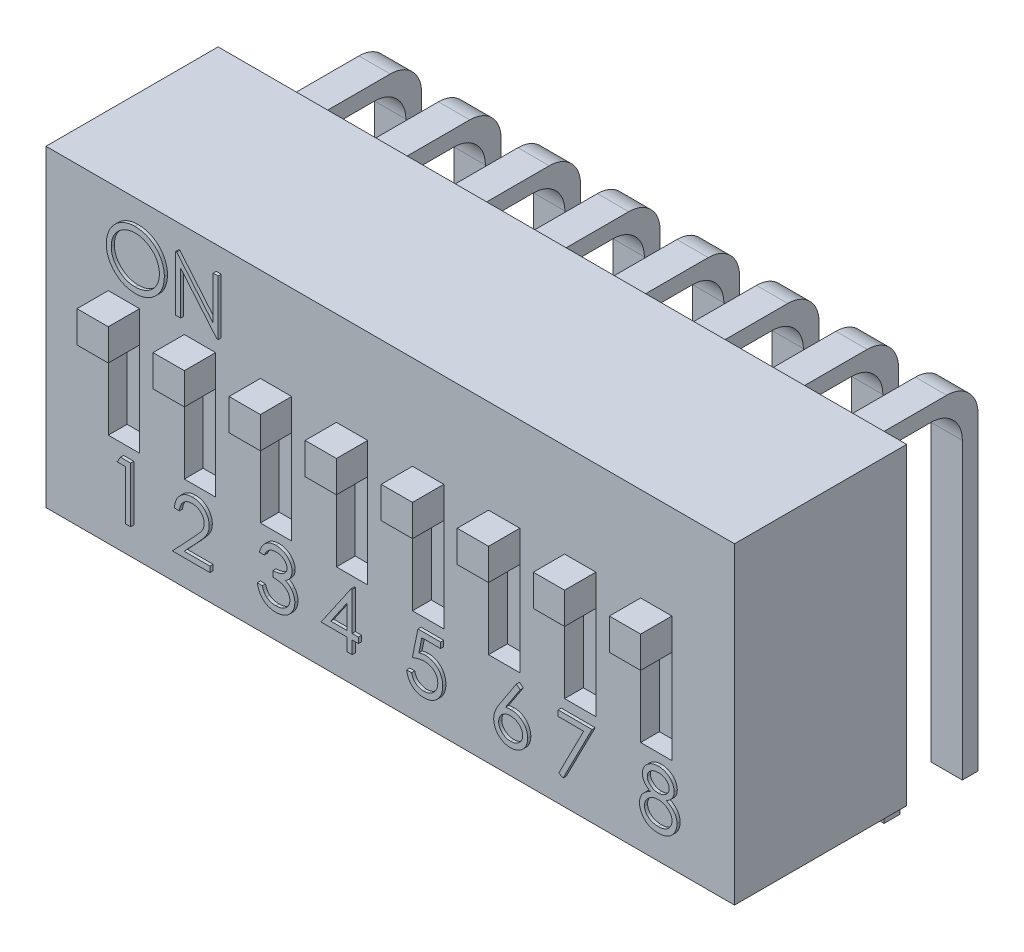
from build123d import *

# Parameters (mm, degrees)
SKETCH_1_W                     = 22
SKETCH_1_H                     = 10
EXTRUDE_1_DEPTH                = 5.5
SKETCH_42_W                    = 1
SKETCH_42_H                    = 4
CUT_EXTRUDE_1_DEPTH            = 0.6
SKETCH_43_W                    = 1
SKETCH_43_H                    = 1.00419659
EXTRUDE_42_DEPTH               = 1.6
WRAP_1_DEPTH                   = 0.1
SKETCH_45_W                    = 1
SKETCH_45_H                    = 0.5
EXTRUDE_43_DEPTH               = 1.5
SKETCH_46_W                    = 1
SKETCH_46_H                    = 0.5
EXTRUDE_44_DEPTH               = 2.6
FILLET_1_R                     = 1
PATTERN_LINEAR_1_COUNT         = 8
PATTERN_LINEAR_1_PITCH         = 2.54
FILLET_1_OF_PATTERN_LINEAR_1_R = 1
SKETCH_47_W                    = 1
SKETCH_47_H                    = 0.5
EXTRUDE_45_DEPTH               = 4
SKETCH_49_W                    = 1
SKETCH_49_H                    = 0.5
EXTRUDE_46_DEPTH               = 10.4
FILLET_2_R                     = 1
PATTERN_LINEAR_2_COUNT         = 8
PATTERN_LINEAR_2_PITCH         = 2.54
FILLET_2_OF_PATTERN_LINEAR_2_R = 1


# Read off the part's stored shape, not the designer's step: 包覆1
with BuildPart() as part:
    # 草图1 → 凸台-拉伸1 (new body)
    with BuildSketch(Plane.XY.offset(6.5)):
        with Locations((11, 5)):
            Rectangle(SKETCH_1_W, SKETCH_1_H)
    extrude(amount=-EXTRUDE_1_DEPTH)

    # 草图42 → 切除-拉伸1 (cut)
    with BuildSketch(Plane.XY.offset(6.5)):
        with Locations((12.21, 5)):
            Rectangle(SKETCH_42_W, SKETCH_42_H)
        with Locations((17.07, 5)):
            Rectangle(SKETCH_42_W, SKETCH_42_H)
        with Locations((19.5, 5)):
            Rectangle(SKETCH_42_W, SKETCH_42_H)
        with Locations((2.49, 5)):
            Rectangle(SKETCH_42_W, SKETCH_42_H)
        with Locations((4.92, 5)):
            Rectangle(SKETCH_42_W, SKETCH_42_H)
        with Locations((7.35, 5)):
            Rectangle(SKETCH_42_W, SKETCH_42_H)
        with Locations((9.78, 5)):
            Rectangle(SKETCH_42_W, SKETCH_42_H)
        with Locations((14.64, 5)):
            Rectangle(SKETCH_42_W, SKETCH_42_H)
    extrude(amount=-CUT_EXTRUDE_1_DEPTH, mode=Mode.SUBTRACT)

    # 草图43 → 凸台-拉伸42 (add)
    with BuildSketch(Plane.XY.offset(5.9)):
        with Locations((2.49, 6.497901705)):
            Rectangle(SKETCH_43_W, SKETCH_43_H)
        with Locations((4.92, 6.497901705)):
            Rectangle(SKETCH_43_W, SKETCH_43_H)
        with Locations((7.35, 6.497901705)):
            Rectangle(SKETCH_43_W, SKETCH_43_H)
        with Locations((9.78, 6.497901705)):
            Rectangle(SKETCH_43_W, SKETCH_43_H)
        with Locations((12.21, 6.497901705)):
            Rectangle(SKETCH_43_W, SKETCH_43_H)
        with Locations((14.64, 6.497901705)):
            Rectangle(SKETCH_43_W, SKETCH_43_H)
        with Locations((17.07, 6.497901705)):
            Rectangle(SKETCH_43_W, SKETCH_43_H)
        with Locations((19.5, 6.497901705)):
            Rectangle(SKETCH_43_W, SKETCH_43_H)
    extrude(amount=EXTRUDE_42_DEPTH)

    # 包覆1 outline → 包覆1 (add)
    # profile 1 of 10: a face of its own
    with BuildSketch(Plane.XY.offset(6.5)):
        with BuildLine():
            add(Edge.make_bspline(
                [(3.880857562, 8.378376083), (3.880076445, 8.346647529), (3.878536774, 8.284106873), (3.865348541, 8.192312359), (3.844665179, 8.104072207), (3.815134522, 8.019533723), (3.777223268, 7.938607728), (3.730528004, 7.86150716), (3.675524298, 7.788206742), (3.612927988, 7.719509487), (3.544690162, 7.65651473), (3.471498718, 7.601623074), (3.394999703, 7.554389091), (3.3142087, 7.516700493), (3.230197173, 7.486577343), (3.142213225, 7.466039311), (3.050669128, 7.452791475), (2.988242074, 7.451270239), (2.956511943, 7.450497032)],
                knots=[0, 0, 0, 0, 0.065226504, 0.128568996, 0.190320378, 0.251377989, 0.312387528, 0.373788704, 0.43643116, 0.500566755, 0.564686795, 0.627135518, 0.688455409, 0.749245746, 0.810155177, 0.871670926, 0.934773496, 1, 1, 1, 1], degree=3))
            add(Edge.make_bspline(
                [(2.942378217, 9.304841762), (2.975039445, 9.304014508), (3.039188792, 9.302389714), (3.133468601, 9.289952229), (3.22347486, 9.268435108), (3.309940763, 9.23977797), (3.391832065, 9.201549768), (3.469765157, 9.155343364), (3.543554614, 9.100674672), (3.612205865, 9.037966292), (3.675029011, 8.969737329), (3.730377771, 8.896925049), (3.776764165, 8.819969701), (3.814857002, 8.739102536), (3.844741619, 8.654506441), (3.865363518, 8.565730416), (3.878536316, 8.473349663), (3.880076331, 8.410340092), (3.880857562, 8.378376083)],
                knots=[0, 0, 0, 0, 0.066570035, 0.130749041, 0.1934128, 0.254989399, 0.316113556, 0.377261758, 0.439400784, 0.502970589, 0.566524976, 0.628231103, 0.689090611, 0.749344669, 0.810169593, 0.871609824, 0.934869184, 1, 1, 1, 1], degree=3))
            add(Edge.make_bspline(
                [(2.026512833, 8.369895848), (2.026782272, 8.390877392), (2.027317752, 8.432575787), (2.033764359, 8.494496653), (2.043118867, 8.555421707), (2.056525386, 8.615177701), (2.074059282, 8.673618356), (2.0947482, 8.731146716), (2.120017091, 8.787179783), (2.148582338, 8.841983001), (2.180464281, 8.894702064), (2.21567944, 8.944534235), (2.252990916, 8.991897674), (2.293894689, 9.035565013), (2.33704266, 9.076806578), (2.383134779, 9.114988582), (2.431889799, 9.150455324), (2.483517506, 9.182417162), (2.536745764, 9.211324345), (2.591616203, 9.236130595), (2.647383603, 9.257421269), (2.704309159, 9.274677558), (2.762241707, 9.288300846), (2.821307686, 9.297577568), (2.88146004, 9.304040617), (2.921984792, 9.304573565), (2.942378217, 9.304841762)],
                knots=[0, 0, 0, 0, 0.043208986, 0.085872872, 0.128120007, 0.170151964, 0.211917621, 0.253753003, 0.296006409, 0.338443357, 0.381015368, 0.422820479, 0.464089056, 0.505125849, 0.545974971, 0.586985211, 0.628338592, 0.670083802, 0.711991602, 0.753039155, 0.794049395, 0.834885543, 0.875498313, 0.9165473, 0.958003779, 1, 1, 1, 1], degree=3))
            add(Edge.make_bspline(
                [(2.956511943, 7.450497032), (2.924548099, 7.451277874), (2.861538855, 7.452817121), (2.769042016, 7.466011718), (2.680203629, 7.486644835), (2.595277746, 7.516131734), (2.514217008, 7.554240418), (2.436862879, 7.600708497), (2.363525848, 7.655846223), (2.294813936, 7.718422235), (2.231944301, 7.786544406), (2.177133028, 7.859536273), (2.130654499, 7.935965809), (2.092673772, 8.016045116), (2.062604778, 8.099387074), (2.042090842, 8.186547616), (2.028818358, 8.277029827), (2.027288892, 8.338636367), (2.026512833, 8.369895848)],
                knots=[0, 0, 0, 0, 0.065818877, 0.129746527, 0.192071954, 0.253459424, 0.314569588, 0.376279881, 0.439025654, 0.503267029, 0.567492823, 0.629704796, 0.690999649, 0.751451651, 0.812004364, 0.873149681, 0.935635484, 1, 1, 1, 1], degree=3))
        make_face()
        with BuildLine():
            add(Edge.make_bspline(
                [(2.184810554, 8.370602534), (2.185453044, 8.34512078), (2.18671702, 8.294990287), (2.197782938, 8.22152777), (2.21482814, 8.150927721), (2.23995467, 8.083576441), (2.2713774, 8.018894997), (2.310196507, 7.957457182), (2.35618819, 7.899246393), (2.408431316, 7.844669015), (2.465542363, 7.794853868), (2.526186238, 7.751127864), (2.589713255, 7.714131429), (2.656289075, 7.683991571), (2.725558272, 7.660108647), (2.797967196, 7.643740448), (2.873033499, 7.632967897), (2.924201726, 7.631933374), (2.950151766, 7.631408713)],
                knots=[0, 0, 0, 0, 0.064503999, 0.126899322, 0.18774654, 0.248149733, 0.308586065, 0.369583005, 0.431826965, 0.496179723, 0.560667855, 0.623504455, 0.685260411, 0.746536822, 0.808327352, 0.870486188, 0.934316883, 1, 1, 1, 1], degree=3))
            add(Edge.make_bspline(
                [(2.950151766, 9.123930081), (2.933412645, 9.123726029), (2.900094431, 9.123319876), (2.850562145, 9.117969892), (2.801681289, 9.110344909), (2.753441769, 9.099468507), (2.706045425, 9.084649798), (2.659050465, 9.067595055), (2.612885434, 9.046820934), (2.567702736, 9.023349769), (2.523900297, 8.99737075), (2.482568499, 8.968658788), (2.443600342, 8.937887215), (2.407091235, 8.904984217), (2.373148382, 8.869782235), (2.341103711, 8.832814936), (2.31224166, 8.79302569), (2.285790596, 8.751493461), (2.262120295, 8.708272346), (2.241071882, 8.663817376), (2.223854307, 8.617765923), (2.209812553, 8.570617597), (2.198170982, 8.522447072), (2.190795949, 8.472888926), (2.18538718, 8.422192183), (2.185004242, 8.387931487), (2.184810554, 8.370602534)],
                knots=[0, 0, 0, 0, 0.042023329, 0.083644911, 0.124983795, 0.166247461, 0.207701556, 0.249631071, 0.29174177, 0.334742875, 0.377460169, 0.419556319, 0.461044176, 0.502096284, 0.542890714, 0.583800819, 0.624863583, 0.666224689, 0.707399186, 0.748556678, 0.789654591, 0.830739726, 0.872070142, 0.913993395, 0.95649813, 1, 1, 1, 1], degree=3))
            add(Edge.make_bspline(
                [(3.722559841, 8.378729426), (3.722357693, 8.395821764), (3.721956695, 8.429727564), (3.716643622, 8.479852659), (3.709033253, 8.52886519), (3.698065539, 8.576572741), (3.683929152, 8.622987474), (3.666498236, 8.668065796), (3.645943739, 8.71197564), (3.62235388, 8.75460848), (3.595837176, 8.795517971), (3.566861902, 8.834627123), (3.534927778, 8.871201481), (3.500947202, 8.906143966), (3.464071399, 8.938709331), (3.42446741, 8.968908379), (3.382616032, 8.99746991), (3.338303497, 9.02323557), (3.292571425, 9.047030045), (3.245644946, 9.067416066), (3.198055678, 9.084738523), (3.149924637, 9.099513343), (3.100846707, 9.11030231), (3.051153508, 9.117976764), (3.00091379, 9.123318014), (2.967126136, 9.123725411), (2.950151766, 9.123930081)],
                knots=[0, 0, 0, 0, 0.042915082, 0.085129971, 0.126473319, 0.167453038, 0.207976333, 0.248249378, 0.288749987, 0.329669857, 0.370537287, 0.411128564, 0.451818913, 0.492405877, 0.533485862, 0.575263062, 0.617440613, 0.660671688, 0.703940204, 0.746867522, 0.7890793, 0.831104042, 0.87323799, 0.91516577, 0.957380658, 1, 1, 1, 1], degree=3))
            add(Edge.make_bspline(
                [(2.950151766, 7.631408713), (2.967593856, 7.631648352), (3.00218676, 7.632123629), (3.053639662, 7.63691066), (3.10416561, 7.644587039), (3.153693735, 7.655639393), (3.202167826, 7.669471914), (3.249790207, 7.685905174), (3.296053631, 7.706407209), (3.341541724, 7.729059549), (3.385082687, 7.754882962), (3.426647737, 7.782620442), (3.465189203, 7.813346692), (3.501670997, 7.845760827), (3.535753206, 7.880516417), (3.567205352, 7.917568275), (3.59592153, 7.957150273), (3.62236255, 7.998619505), (3.645949909, 8.041958887), (3.66650128, 8.086575034), (3.683936624, 8.132358085), (3.698011704, 8.179374075), (3.709041282, 8.227533709), (3.716641083, 8.276901471), (3.721957161, 8.3273786), (3.722357855, 8.361519353), (3.722559841, 8.378729426)],
                knots=[0, 0, 0, 0, 0.043633218, 0.086537777, 0.129177336, 0.171436324, 0.213415895, 0.255265955, 0.297369481, 0.339940748, 0.382347459, 0.423952947, 0.464871163, 0.505572294, 0.546002577, 0.586567975, 0.627064799, 0.668270684, 0.709549225, 0.750428154, 0.791096194, 0.832027145, 0.873135955, 0.914610764, 0.956955986, 1, 1, 1, 1], degree=3))
        make_face(mode=Mode.SUBTRACT)
    # profile 2 of 10: a face of its own
    with BuildSketch(Plane.XY.offset(6.5)):
        with BuildLine():
            add(Edge.make_bspline(
                [(4.206196581, 2.142210375), (4.207228281, 2.16321118), (4.209254513, 2.204456201), (4.218743373, 2.264591662), (4.23232072, 2.32207166), (4.251517603, 2.376434672), (4.275358466, 2.428161372), (4.303948598, 2.477046301), (4.337812166, 2.522902971), (4.376217941, 2.565306277), (4.417930707, 2.604206363), (4.462938066, 2.637798489), (4.51023298, 2.666180807), (4.559671963, 2.689908259), (4.611812802, 2.707718419), (4.666182338, 2.720933293), (4.723019442, 2.72888407), (4.761744374, 2.729738693), (4.781439192, 2.730173338)],
                knots=[0, 0, 0, 0, 0.068790794, 0.135103289, 0.198978674, 0.2619043, 0.323494969, 0.385195378, 0.446969239, 0.509764777, 0.572250569, 0.633405176, 0.693251163, 0.752583163, 0.812579266, 0.873275085, 0.935549943, 1, 1, 1, 1], degree=3))
            Line((4.206196581, 2.142210375), (4.364494302, 2.142210375))
            add(Edge.make_bspline(
                [(4.7733123, 2.549261657), (4.759518269, 2.548901304), (4.73242907, 2.548193629), (4.692656383, 2.543243318), (4.654714741, 2.534703152), (4.618508703, 2.523022844), (4.583977006, 2.508176671), (4.551287587, 2.489685196), (4.52051383, 2.467619706), (4.491597884, 2.442602441), (4.464956116, 2.414749325), (4.441548365, 2.383699859), (4.421095311, 2.350020964), (4.403250181, 2.313803511), (4.388758226, 2.274718868), (4.377684456, 2.232905779), (4.368922037, 2.188545797), (4.365994727, 2.157912044), (4.364494302, 2.142210375)],
                knots=[0, 0, 0, 0, 0.064438672, 0.126546911, 0.186887153, 0.245877536, 0.304040885, 0.362191218, 0.420975933, 0.480660283, 0.540600275, 0.600689098, 0.66193579, 0.724442506, 0.789038394, 0.856313757, 0.926352028, 1, 1, 1, 1], degree=3))
            add(Edge.make_bspline(
                [(5.155982906, 2.191678413), (5.155662512, 2.20371388), (5.155031077, 2.227433473), (5.149458349, 2.262210185), (5.141036784, 2.295756738), (5.128969134, 2.32817632), (5.113040341, 2.359142978), (5.093650978, 2.388694407), (5.071279796, 2.417263845), (5.045400386, 2.44405142), (5.016970771, 2.468585202), (4.986937161, 2.490318372), (4.95516191, 2.50848094), (4.921778991, 2.523369925), (4.886881473, 2.535049581), (4.850401859, 2.543142595), (4.812440947, 2.548223847), (4.786520098, 2.548911347), (4.7733123, 2.549261657)],
                knots=[0, 0, 0, 0, 0.061965401, 0.122121906, 0.180988497, 0.239933216, 0.299905831, 0.359988847, 0.421775742, 0.486575826, 0.551534805, 0.615017543, 0.677258617, 0.739729962, 0.803050103, 0.866495132, 0.931973474, 1, 1, 1, 1], degree=3))
            add(Edge.make_bspline(
                [(4.822426994, 1.651063429), (4.83908208, 1.66844948), (4.871073091, 1.701844527), (4.91632066, 1.750599908), (4.95696015, 1.795830827), (4.99325463, 1.837451825), (5.024416753, 1.876071703), (5.052070616, 1.910439669), (5.074227878, 1.942065919), (5.098274923, 1.97872488), (5.121565303, 2.023483468), (5.141579069, 2.078181002), (5.153782584, 2.13448799), (5.155246529, 2.17253862), (5.155982906, 2.191678413)],
                knots=[0, 0, 0, 0, 0.110802644, 0.212829202, 0.30610131, 0.390647321, 0.466924469, 0.534481039, 0.593586941, 0.644557005, 0.736200453, 0.825024026, 0.911985585, 1, 1, 1, 1], degree=3))
            Line((4.822426994, 1.651063429), (4.138354701, 0.921056529))
            Line((4.138354701, 0.921056529), (5.336894587, 0.921056529))
            Line((5.336894587, 0.921056529), (5.336894587, 1.10196821))
            Line((5.336894587, 1.10196821), (4.516078503, 1.10196821))
            Line((4.516078503, 1.10196821), (4.957404069, 1.572974598))
            add(Edge.make_bspline(
                [(5.314280627, 2.205812138), (5.313427276, 2.181244777), (5.31173555, 2.132541177), (5.297264415, 2.060970195), (5.274663198, 1.99162748), (5.247450244, 1.935819395), (5.219997861, 1.890848547), (5.195259316, 1.853822652), (5.166298875, 1.813956007), (5.132695029, 1.771382111), (5.095142907, 1.725767488), (5.053302372, 1.677139694), (5.006875062, 1.626001144), (4.97428923, 1.591073321), (4.957404069, 1.572974598)],
                knots=[0, 0, 0, 0, 0.098702196, 0.195672309, 0.292422427, 0.391342544, 0.444462441, 0.504228775, 0.570352338, 0.642545753, 0.722287505, 0.807921123, 0.900469538, 1, 1, 1, 1], degree=3))
            add(Edge.make_bspline(
                [(4.781439192, 2.730173338), (4.800780523, 2.729720545), (4.838785547, 2.728830822), (4.894253308, 2.721190144), (4.947057738, 2.70922312), (4.997095621, 2.692433208), (5.043967725, 2.669863278), (5.088026164, 2.642751026), (5.129795461, 2.611394207), (5.167394912, 2.57447661), (5.201920809, 2.535065091), (5.231706469, 2.492989838), (5.257213897, 2.449533015), (5.278475148, 2.404363247), (5.294126456, 2.357055229), (5.306009125, 2.30829771), (5.312725718, 2.257586), (5.313756547, 2.223262458), (5.314280627, 2.205812138)],
                knots=[0, 0, 0, 0, 0.06947546, 0.136516798, 0.200788824, 0.263829673, 0.325735023, 0.387290692, 0.449509219, 0.51296782, 0.576275215, 0.6375801, 0.697902606, 0.757172088, 0.816598528, 0.876653171, 0.937289642, 1, 1, 1, 1], degree=3))
        make_face()
    # profile 3 of 10: a face of its own
    with BuildSketch(Plane.XY.offset(6.5)):
        with BuildLine():
            add(Edge.make_bspline(
                [(6.919871795, 2.277894136), (6.924160338, 2.295650189), (6.93254409, 2.330361822), (6.950030565, 2.379955957), (6.96908019, 2.426887255), (6.991954858, 2.470276943), (7.016905698, 2.510997025), (7.045492149, 2.548123925), (7.076395343, 2.582601888), (7.110576964, 2.613199432), (7.146423551, 2.640906463), (7.184440205, 2.664530003), (7.22386206, 2.684852096), (7.26496225, 2.701594039), (7.307863138, 2.714206108), (7.352176877, 2.723356562), (7.398019593, 2.729298909), (7.429138419, 2.729878857), (7.444939681, 2.730173338)],
                knots=[0, 0, 0, 0, 0.072625346, 0.141976611, 0.208984928, 0.27395687, 0.336889347, 0.398744953, 0.460115885, 0.520824923, 0.580994459, 0.640151928, 0.698622451, 0.757271081, 0.816426694, 0.876254048, 0.937165293, 1, 1, 1, 1], degree=3))
            Line((6.919871795, 2.277894136), (7.078169516, 2.277894136))
            add(Edge.make_bspline(
                [(7.44705974, 2.549261657), (7.426975764, 2.548560455), (7.387747089, 2.547190844), (7.331194333, 2.535194881), (7.278620701, 2.516055132), (7.238434944, 2.49320873), (7.208759996, 2.470655932), (7.187554555, 2.45095965), (7.16673033, 2.429070885), (7.14765731, 2.403641466), (7.128368441, 2.37639352), (7.110807888, 2.345941903), (7.093743678, 2.313080958), (7.083461441, 2.289850222), (7.078169516, 2.277894136)],
                knots=[0, 0, 0, 0, 0.122711942, 0.239684964, 0.351815855, 0.463766133, 0.520817793, 0.579448291, 0.640604145, 0.705297512, 0.773633881, 0.844669382, 0.920056508, 1, 1, 1, 1], degree=3))
            add(Edge.make_bspline(
                [(7.801816239, 2.272593989), (7.801607389, 2.281805392), (7.801191892, 2.300131042), (7.795951994, 2.326904391), (7.788077974, 2.352859232), (7.777252872, 2.377885192), (7.762763685, 2.401808703), (7.74542416, 2.424833727), (7.724777538, 2.446828806), (7.701118523, 2.467330396), (7.675712573, 2.486868861), (7.647868441, 2.503456289), (7.61842567, 2.517640507), (7.587351666, 2.529337359), (7.554545585, 2.538136286), (7.520161566, 2.544453952), (7.484134043, 2.548403881), (7.459554638, 2.548972567), (7.44705974, 2.549261657)],
                knots=[0, 0, 0, 0, 0.055274549, 0.109966094, 0.163247443, 0.218076185, 0.273300874, 0.3309093, 0.390994523, 0.454175953, 0.518861541, 0.583310532, 0.648516682, 0.715030887, 0.782502073, 0.852322685, 0.92492849, 1, 1, 1, 1], degree=3))
            add(Edge.make_bspline(
                [(7.349537037, 1.983912655), (7.37135945, 1.984282972), (7.414104196, 1.985008334), (7.476542992, 1.993781418), (7.536249781, 2.00591729), (7.591901353, 2.024506256), (7.642625109, 2.046096406), (7.686631417, 2.071220337), (7.723303749, 2.099147611), (7.752463892, 2.130309284), (7.774401241, 2.163729962), (7.790440937, 2.198562564), (7.799915705, 2.235112388), (7.801180497, 2.260056129), (7.801816239, 2.272593989)],
                knots=[0, 0, 0, 0, 0.110165553, 0.215787256, 0.318027435, 0.417573954, 0.511650488, 0.596162097, 0.672934533, 0.743669557, 0.810677001, 0.874058962, 0.936696302, 1, 1, 1, 1], degree=3))
            Line((7.349537037, 1.983912655), (7.349537037, 1.803000974))
            add(Edge.make_bspline(
                [(7.89227208, 1.429870632), (7.891500856, 1.446305711), (7.889962247, 1.479094092), (7.878215463, 1.52733271), (7.858893893, 1.573810382), (7.831844651, 1.617734134), (7.798917518, 1.658442624), (7.760432029, 1.694764363), (7.716068596, 1.724735401), (7.675237154, 1.745442779), (7.639069794, 1.759572575), (7.60811839, 1.768984165), (7.573467244, 1.776953745), (7.535535394, 1.784368263), (7.494037027, 1.790678625), (7.449017322, 1.795940968), (7.400467157, 1.800151644), (7.366856926, 1.802031997), (7.349537037, 1.803000974)],
                knots=[0, 0, 0, 0, 0.066909186, 0.13348544, 0.201035117, 0.27123434, 0.342879984, 0.41383613, 0.485976622, 0.560229557, 0.599884181, 0.64405484, 0.691891932, 0.744687524, 0.801491775, 0.862857698, 0.929328379, 1, 1, 1, 1], degree=3))
            add(Edge.make_bspline(
                [(7.443172966, 1.05674029), (7.459679691, 1.057050687), (7.491957168, 1.05765764), (7.53905545, 1.063239445), (7.583861981, 1.071368661), (7.625879289, 1.083924014), (7.665657759, 1.099436586), (7.702639781, 1.118914155), (7.737310835, 1.141766455), (7.769226844, 1.167740555), (7.797925572, 1.196175198), (7.823194295, 1.225915912), (7.844675772, 1.256837302), (7.862004003, 1.289110482), (7.875687019, 1.322601808), (7.885001965, 1.357405266), (7.891478721, 1.393236031), (7.89200618, 1.417592297), (7.89227208, 1.429870632)],
                knots=[0, 0, 0, 0, 0.076071737, 0.148751715, 0.218402794, 0.285759581, 0.350598024, 0.414964045, 0.478069339, 0.541760676, 0.604349859, 0.664075021, 0.721463623, 0.777587128, 0.832644447, 0.887843511, 0.943460343, 1, 1, 1, 1], degree=3))
            add(Edge.make_bspline(
                [(7.148484798, 1.152142934), (7.15836085, 1.144528813), (7.17808247, 1.129324075), (7.210219634, 1.109920477), (7.244018208, 1.093107579), (7.280210524, 1.080264605), (7.318015587, 1.069390149), (7.358044457, 1.062273856), (7.399943983, 1.057391325), (7.428553134, 1.056960467), (7.443172966, 1.05674029)],
                knots=[0, 0, 0, 0, 0.118271305, 0.236177533, 0.355662933, 0.475904165, 0.600127342, 0.728608116, 0.861313476, 1, 1, 1, 1], degree=3))
            add(Edge.make_bspline(
                [(7.010327635, 1.395949692), (7.014451754, 1.382368244), (7.022473524, 1.35595115), (7.03612819, 1.317931631), (7.05168482, 1.283078167), (7.068373506, 1.251135086), (7.085900739, 1.221787804), (7.105512625, 1.195812338), (7.125756599, 1.172067772), (7.141016432, 1.15869013), (7.148484798, 1.152142934)],
                knots=[0, 0, 0, 0, 0.149770386, 0.29131641, 0.425966373, 0.552159574, 0.671527414, 0.786121629, 0.895325073, 1, 1, 1, 1], degree=3))
            Line((7.010327635, 1.395949692), (6.852029915, 1.395949692))
            add(Edge.make_bspline(
                [(7.440346221, 0.875828609), (7.421488081, 0.876266161), (7.384381551, 0.877127117), (7.329830264, 0.883012761), (7.277759408, 0.893762407), (7.228098579, 0.908227962), (7.18080366, 0.926568244), (7.136018972, 0.949407429), (7.093468986, 0.976274734), (7.053555229, 1.007487296), (7.016282458, 1.042402892), (6.982641205, 1.081641361), (6.952070595, 1.124477354), (6.925389185, 1.171408419), (6.901381674, 1.221828052), (6.881635715, 1.276381859), (6.864256083, 1.33458214), (6.856175726, 1.375140366), (6.852029915, 1.395949692)],
                knots=[0, 0, 0, 0, 0.06554117, 0.128963168, 0.190377136, 0.250092362, 0.308548432, 0.366397963, 0.424542189, 0.483169996, 0.5422434, 0.601739352, 0.662506002, 0.724855513, 0.789127829, 0.8563464, 0.926295235, 1, 1, 1, 1], degree=3))
            add(Edge.make_bspline(
                [(8.050569801, 1.445064386), (8.049665423, 1.420365043), (8.047860923, 1.371082591), (8.031731886, 1.298271918), (8.006728387, 1.227098748), (7.971220328, 1.159025317), (7.92794583, 1.095333617), (7.876461782, 1.038346747), (7.817353155, 0.989361736), (7.751431261, 0.948434359), (7.680010327, 0.915717787), (7.60362104, 0.893010267), (7.523364069, 0.878220814), (7.468327058, 0.876634892), (7.440346221, 0.875828609)],
                knots=[0, 0, 0, 0, 0.079648251, 0.158921676, 0.239619495, 0.32260943, 0.406034637, 0.487602095, 0.569684627, 0.653036145, 0.737435718, 0.822477816, 0.909747655, 1, 1, 1, 1], degree=3))
            add(Edge.make_bspline(
                [(7.945273549, 1.75847974), (7.953761051, 1.746859365), (7.970597066, 1.723808907), (7.991378466, 1.686748883), (8.010231472, 1.649278092), (8.024922257, 1.610392201), (8.036298769, 1.570541913), (8.044430817, 1.5296588), (8.049482666, 1.48770948), (8.050206139, 1.459329777), (8.050569801, 1.445064386)],
                knots=[0, 0, 0, 0, 0.12813551, 0.254172712, 0.378111645, 0.501712263, 0.623986309, 0.747095614, 0.872874637, 1, 1, 1, 1], degree=3))
            add(Edge.make_bspline(
                [(7.754114917, 1.909003912), (7.77287854, 1.899943484), (7.810054702, 1.881992156), (7.860728977, 1.846787072), (7.906730129, 1.806138833), (7.932383987, 1.774417734), (7.945273549, 1.75847974)],
                knots=[0, 0, 0, 0, 0.2538796, 0.503008917, 0.750291081, 1, 1, 1, 1], degree=3))
            add(Edge.make_bspline(
                [(7.96011396, 2.271887303), (7.959527547, 2.253237053), (7.958380028, 2.216741409), (7.948636454, 2.16346113), (7.932239211, 2.113244927), (7.909525481, 2.065881405), (7.880123192, 2.02167087), (7.844506396, 1.980513854), (7.802423706, 1.94222781), (7.77053313, 1.920295377), (7.754114917, 1.909003912)],
                knots=[0, 0, 0, 0, 0.128067549, 0.250608319, 0.370630166, 0.490072247, 0.610374764, 0.73431307, 0.863216504, 1, 1, 1, 1], degree=3))
            add(Edge.make_bspline(
                [(7.444939681, 2.730173338), (7.467962333, 2.72947825), (7.513505446, 2.728103235), (7.580413807, 2.71554715), (7.644935259, 2.695678135), (7.706363571, 2.668225106), (7.763422066, 2.634364833), (7.814189906, 2.594065144), (7.857978958, 2.548103592), (7.89471541, 2.497337577), (7.923479397, 2.443082618), (7.944689594, 2.387242856), (7.957602107, 2.329950752), (7.959275563, 2.29126752), (7.96011396, 2.271887303)],
                knots=[0, 0, 0, 0, 0.090254249, 0.178539792, 0.266093034, 0.354630978, 0.441886153, 0.525746915, 0.608113634, 0.690197273, 0.770821484, 0.848326181, 0.92401174, 1, 1, 1, 1], degree=3))
        make_face()
    # profile 4 of 10: a face of its own
    with BuildSketch(Plane.XY.offset(6.5)):
        with BuildLine():
            add(Edge.make_bspline(
                [(12.014019654, 2.040094212), (12.032694638, 2.045249944), (12.068874466, 2.05523836), (12.122274873, 2.066328569), (12.17297015, 2.073013932), (12.205866864, 2.073926775), (12.221785412, 2.074368495)],
                knots=[0, 0, 0, 0, 0.275068369, 0.53290146, 0.77397346, 1, 1, 1, 1], degree=3))
            Line((12.014019654, 2.040094212), (12.109068955, 2.504033737))
            Line((12.109068955, 2.504033737), (12.709045584, 2.504033737))
            Line((12.709045584, 2.504033737), (12.709045584, 2.684945418))
            Line((12.709045584, 2.684945418), (11.98539886, 2.684945418))
            Line((11.98539886, 2.684945418), (11.804487179, 1.803000974))
            add(Edge.make_bspline(
                [(12.193164619, 1.893456814), (12.1794925, 1.893164215), (12.151263043, 1.892560071), (12.107960666, 1.888111797), (12.062456504, 1.880935644), (12.014924993, 1.871064797), (11.965223387, 1.858147548), (11.913456574, 1.842668415), (11.85951571, 1.824161693), (11.823170666, 1.810185538), (11.804487179, 1.803000974)],
                knots=[0, 0, 0, 0, 0.102203037, 0.211023342, 0.325099662, 0.446502097, 0.573787718, 0.70890071, 0.850357871, 1, 1, 1, 1], degree=3))
            add(Edge.make_bspline(
                [(12.618589744, 1.504072688), (12.618257891, 1.518221976), (12.617608336, 1.545917193), (12.612301263, 1.586435841), (12.603070091, 1.624774239), (12.590257262, 1.661117524), (12.573989415, 1.695499973), (12.554109726, 1.72795707), (12.530245117, 1.758061026), (12.502984522, 1.785825924), (12.473120351, 1.811450127), (12.440138782, 1.833294171), (12.404730009, 1.851670827), (12.367320648, 1.8675297), (12.327020877, 1.878919758), (12.284628765, 1.887471033), (12.239686535, 1.892417665), (12.208959244, 1.893104013), (12.193164619, 1.893456814)],
                knots=[0, 0, 0, 0, 0.065351382, 0.127916032, 0.188360206, 0.247216077, 0.305630129, 0.36376984, 0.422660914, 0.482687294, 0.543300221, 0.604117955, 0.664964891, 0.727413494, 0.791467625, 0.858055443, 0.927036815, 1, 1, 1, 1], degree=3))
            add(Edge.make_bspline(
                [(12.170904002, 1.05674029), (12.186002107, 1.057153936), (12.215730399, 1.057968408), (12.259480582, 1.064237275), (12.30171961, 1.073892083), (12.342030698, 1.08834078), (12.381119252, 1.105901412), (12.417996509, 1.128436391), (12.453729309, 1.154370606), (12.487206979, 1.184082876), (12.51786813, 1.21682554), (12.544959509, 1.25183994), (12.567525651, 1.289192478), (12.586542444, 1.328236488), (12.600982797, 1.369399887), (12.611284403, 1.412489765), (12.617333564, 1.457612553), (12.618165706, 1.488389546), (12.618589744, 1.504072688)],
                knots=[0, 0, 0, 0, 0.064207295, 0.12642469, 0.187680284, 0.248216424, 0.30830506, 0.369660991, 0.431698552, 0.495946892, 0.559758024, 0.622295408, 0.683910635, 0.745092408, 0.806740225, 0.869086618, 0.933290003, 1, 1, 1, 1], degree=3))
            add(Edge.make_bspline(
                [(11.781873219, 1.373335731), (11.785768167, 1.356515059), (11.793254472, 1.324184793), (11.809686735, 1.278761458), (11.82977787, 1.238283119), (11.853668157, 1.202214321), (11.882167577, 1.170762168), (11.914688361, 1.142732934), (11.951149317, 1.117446262), (11.991664952, 1.096368915), (12.034408052, 1.078392995), (12.079143907, 1.066422895), (12.124654431, 1.058006175), (12.155435991, 1.057163661), (12.170904002, 1.05674029)],
                knots=[0, 0, 0, 0, 0.094687252, 0.181994156, 0.264376949, 0.342179862, 0.418617611, 0.496509075, 0.577369092, 0.661510592, 0.746732551, 0.831257984, 0.915205616, 1, 1, 1, 1], degree=3))
            Line((11.781873219, 1.373335731), (11.623575499, 1.373335731))
            add(Edge.make_bspline(
                [(12.161717081, 0.875828609), (12.144141601, 0.876176769), (12.10956392, 0.876861734), (12.058904745, 0.884027399), (12.010163655, 0.894290166), (11.963733008, 0.909729874), (11.919196697, 0.929075852), (11.877154295, 0.953526462), (11.836531543, 0.981234185), (11.798979842, 1.013931823), (11.764127356, 1.049671076), (11.732928441, 1.088455284), (11.705142869, 1.129644328), (11.681215592, 1.173438239), (11.660805874, 1.219721943), (11.64477213, 1.268668852), (11.631831055, 1.320023219), (11.626356236, 1.355378361), (11.623575499, 1.373335731)],
                knots=[0, 0, 0, 0, 0.065421144, 0.128708372, 0.190236142, 0.250724402, 0.310637179, 0.370766408, 0.431614744, 0.493522974, 0.555883455, 0.617342367, 0.678668039, 0.74071136, 0.802985363, 0.86680258, 0.932347171, 1, 1, 1, 1], degree=3))
            add(Edge.make_bspline(
                [(12.776887464, 1.497359169), (12.776552288, 1.482984875), (12.775886464, 1.454430544), (12.772500509, 1.412024538), (12.765981318, 1.370516285), (12.757228537, 1.329900278), (12.745867874, 1.290253412), (12.732115057, 1.251462206), (12.715284519, 1.213768098), (12.696823469, 1.176814427), (12.676036554, 1.141436608), (12.652965639, 1.108351603), (12.628590967, 1.077063096), (12.602363761, 1.047906651), (12.574040243, 1.02107386), (12.543963435, 0.99640548), (12.512373334, 0.973484334), (12.478781208, 0.953240838), (12.443935592, 0.934612682), (12.407333276, 0.919330582), (12.369807447, 0.905667736), (12.330818005, 0.89477722), (12.290453267, 0.88624375), (12.248646693, 0.880447813), (12.205617546, 0.876226354), (12.176450377, 0.875962095), (12.161717081, 0.875828609)],
                knots=[0, 0, 0, 0, 0.044014471, 0.087434124, 0.130118399, 0.172553695, 0.214554756, 0.256298092, 0.298438225, 0.340849003, 0.382715189, 0.423924045, 0.464246243, 0.504073671, 0.543861906, 0.583566725, 0.623094319, 0.663229061, 0.703551259, 0.743937895, 0.784541255, 0.825750111, 0.867757363, 0.910745164, 0.954914447, 1, 1, 1, 1], degree=3))
            add(Edge.make_bspline(
                [(12.221785412, 2.074368495), (12.241482376, 2.07394217), (12.280211529, 2.073103909), (12.336877189, 2.065054604), (12.390969559, 2.052384885), (12.442375516, 2.034685257), (12.491190158, 2.012052177), (12.536964366, 1.983779588), (12.580385219, 1.95075287), (12.620673748, 1.912781376), (12.657223697, 1.870991513), (12.689359732, 1.826058777), (12.716655958, 1.778419836), (12.738609196, 1.727619529), (12.756139396, 1.67421948), (12.767807266, 1.617657821), (12.775576798, 1.558467697), (12.776444826, 1.517996743), (12.776887464, 1.497359169)],
                knots=[0, 0, 0, 0, 0.065807646, 0.129394274, 0.190894061, 0.251281069, 0.310814964, 0.370370987, 0.430768263, 0.492881251, 0.555103948, 0.616067051, 0.677256033, 0.738259805, 0.800762134, 0.864777582, 0.931045295, 1, 1, 1, 1], degree=3))
        make_face()
    # profile 5 of 10: a face of its own
    with BuildSketch(Plane.XY.offset(6.5)):
        with BuildLine():
            add(Edge.make_bspline(
                [(14.784583111, 1.921724264), (14.815612576, 1.926670138), (14.876139056, 1.936317625), (14.937404409, 1.93790913), (14.967261507, 1.938684734)],
                knots=[0, 0, 0, 0, 0.512659336, 1, 1, 1, 1], degree=3))
            Line((14.784583111, 1.921724264), (15.250642695, 2.634417351))
            Line((15.250642695, 2.634417351), (15.128739316, 2.730173338))
            Line((15.128739316, 2.730173338), (14.602258057, 1.925257695))
            add(Edge.make_bspline(
                [(14.405092593, 1.412910162), (14.405688003, 1.431075487), (14.406903718, 1.468165612), (14.415392252, 1.524339943), (14.42903205, 1.581818068), (14.444307452, 1.63057911), (14.460447343, 1.6705244), (14.473879376, 1.702729731), (14.490598017, 1.735871224), (14.508425078, 1.771085319), (14.528965246, 1.807464485), (14.551298927, 1.845616731), (14.576043592, 1.88493529), (14.593390262, 1.911617484), (14.602258057, 1.925257695)],
                knots=[0, 0, 0, 0, 0.09781819, 0.199726053, 0.305276357, 0.415811491, 0.474472231, 0.53727388, 0.603657421, 0.674298863, 0.749834485, 0.828598477, 0.912377778, 1, 1, 1, 1], degree=3))
            add(Edge.make_bspline(
                [(14.9393474, 0.875828609), (14.915612158, 0.876598776), (14.8685968, 0.878124342), (14.799435828, 0.891714319), (14.732981053, 0.913741311), (14.669698072, 0.944087396), (14.611076175, 0.982418155), (14.558630398, 1.028562637), (14.512622242, 1.08153447), (14.474333445, 1.141325439), (14.443964957, 1.20557633), (14.421190669, 1.272572437), (14.407887801, 1.34206965), (14.406028885, 1.389181176), (14.405092593, 1.412910162)],
                knots=[0, 0, 0, 0, 0.084334722, 0.167052318, 0.249566077, 0.332740482, 0.415914886, 0.49782801, 0.580372589, 0.664600121, 0.749466693, 0.832510234, 0.915639282, 1, 1, 1, 1], degree=3))
            add(Edge.make_bspline(
                [(15.490562678, 1.41609025), (15.489845478, 1.391406034), (15.488434199, 1.342833339), (15.474371572, 1.272087935), (15.452519687, 1.204690993), (15.421284981, 1.141718561), (15.382488303, 1.083256949), (15.335176977, 1.031456337), (15.28102887, 0.985257549), (15.21980338, 0.946625046), (15.153913077, 0.915075096), (15.084692031, 0.892414041), (15.012812477, 0.878462451), (14.964026027, 0.876713378), (14.9393474, 0.875828609)],
                knots=[0, 0, 0, 0, 0.085947943, 0.169125212, 0.250399107, 0.332289736, 0.413364288, 0.494172283, 0.576021735, 0.660756969, 0.745783126, 0.830043593, 0.914027546, 1, 1, 1, 1], degree=3))
            add(Edge.make_bspline(
                [(14.967261507, 1.938684734), (14.985188916, 1.938202884), (15.020478487, 1.937254377), (15.072289852, 1.929954976), (15.122076339, 1.918451844), (15.169631596, 1.901683684), (15.215126313, 1.880263846), (15.258821568, 1.854592273), (15.299895994, 1.823343378), (15.338878533, 1.788436039), (15.374270761, 1.749773115), (15.405605519, 1.708749425), (15.431926164, 1.665407711), (15.453281275, 1.619769926), (15.469864289, 1.571906418), (15.481953301, 1.521878427), (15.489099365, 1.469651455), (15.490069752, 1.434132692), (15.490562678, 1.41609025)],
                knots=[0, 0, 0, 0, 0.065230804, 0.128404896, 0.190067072, 0.250943366, 0.311545833, 0.372862802, 0.435023674, 0.499071725, 0.563091075, 0.625510106, 0.686680036, 0.747282503, 0.808563495, 0.870742104, 0.934340952, 1, 1, 1, 1], degree=3))
        make_face()
        with BuildLine():
            add(Edge.make_bspline(
                [(14.563390313, 1.406549985), (14.56370598, 1.394631146), (14.564324954, 1.371260077), (14.569945369, 1.3368193), (14.57853051, 1.303675874), (14.591301265, 1.272000664), (14.606534657, 1.241310853), (14.626645674, 1.21271807), (14.64892953, 1.184485733), (14.675566235, 1.15878261), (14.704153009, 1.134865978), (14.734694091, 1.113961247), (14.766524706, 1.096077343), (14.800074589, 1.082061432), (14.834867743, 1.070558716), (14.871194054, 1.062464241), (14.909078787, 1.057887944), (14.934741827, 1.057127862), (14.947827635, 1.05674029)],
                knots=[0, 0, 0, 0, 0.061841703, 0.121262373, 0.180745949, 0.239230902, 0.298307559, 0.358182798, 0.420359231, 0.484792416, 0.549938484, 0.613718278, 0.676680707, 0.73915417, 0.802199703, 0.866740178, 0.932049652, 1, 1, 1, 1], degree=3))
            add(Edge.make_bspline(
                [(14.934047253, 1.757773053), (14.920610328, 1.757380944), (14.894364111, 1.756615041), (14.855857199, 1.752167394), (14.819413616, 1.743791912), (14.784550537, 1.733124753), (14.75191975, 1.718457735), (14.721284105, 1.70064155), (14.69252513, 1.679665798), (14.665944054, 1.65582764), (14.641844462, 1.629728116), (14.62109048, 1.601773238), (14.603188318, 1.572636715), (14.588632798, 1.542075101), (14.577298514, 1.510100079), (14.569099832, 1.476858711), (14.564537028, 1.442128089), (14.563777936, 1.418576391), (14.563390313, 1.406549985)],
                knots=[0, 0, 0, 0, 0.070599289, 0.137900921, 0.203196198, 0.266789725, 0.329106387, 0.390653545, 0.452653057, 0.51574804, 0.577926341, 0.638930012, 0.698350718, 0.757296037, 0.816393767, 0.87626691, 0.936817109, 1, 1, 1, 1], degree=3))
            add(Edge.make_bspline(
                [(15.332264957, 1.406549985), (15.331987627, 1.41859208), (15.331443318, 1.442226797), (15.325286868, 1.476843176), (15.316748449, 1.510268974), (15.303855414, 1.542294115), (15.28710525, 1.572792221), (15.266702899, 1.601917354), (15.24310077, 1.629892806), (15.215837327, 1.655878825), (15.186158519, 1.679639455), (15.154602252, 1.700614391), (15.121588313, 1.718316264), (15.087150175, 1.733086113), (15.050893246, 1.743744777), (15.013402877, 1.752137482), (14.974199568, 1.756603658), (14.947601833, 1.75737829), (14.934047253, 1.757773053)],
                knots=[0, 0, 0, 0, 0.061137915, 0.119993844, 0.178225322, 0.23625642, 0.294929377, 0.354715749, 0.416729664, 0.480664408, 0.54583177, 0.609758105, 0.672971228, 0.736016869, 0.799839398, 0.864775357, 0.931087623, 1, 1, 1, 1], degree=3))
            add(Edge.make_bspline(
                [(14.947827635, 1.05674029), (14.960913422, 1.057127893), (14.98657642, 1.057888034), (15.024461458, 1.062463899), (15.060786642, 1.070559971), (15.095583891, 1.082056883), (15.12911866, 1.096094218), (15.160921436, 1.113849987), (15.191173689, 1.134994539), (15.21977923, 1.158741739), (15.246305064, 1.184632025), (15.269123375, 1.212466052), (15.288618496, 1.241541944), (15.304460329, 1.271879769), (15.317090424, 1.303695027), (15.3257191, 1.336814169), (15.331327908, 1.371261421), (15.331948478, 1.3946316), (15.332264957, 1.406549985)],
                knots=[0, 0, 0, 0, 0.067962371, 0.133283403, 0.197835298, 0.260891987, 0.323376504, 0.386350075, 0.449637731, 0.514795327, 0.579239913, 0.641814178, 0.701358565, 0.760726766, 0.819222068, 0.878716169, 0.938147354, 1, 1, 1, 1], degree=3))
        make_face(mode=Mode.SUBTRACT)
    # profile 6 of 10: a face of its own
    with BuildSketch(Plane.XY.offset(6.5)):
        with BuildLine():
            add(Edge.make_bspline(
                [(20.262108262, 1.434817435), (20.261719491, 1.417834848), (20.260949966, 1.384219935), (20.254247196, 1.33460622), (20.244211687, 1.286420918), (20.229556536, 1.239674591), (20.210550185, 1.194625184), (20.187127335, 1.151234136), (20.160612957, 1.108790278), (20.13931917, 1.082674944), (20.12854456, 1.069460642)],
                knots=[0, 0, 0, 0, 0.128158186, 0.253673136, 0.377325306, 0.499384555, 0.622918368, 0.745839393, 0.871395285, 1, 1, 1, 1], degree=3))
            add(Edge.make_bspline(
                [(19.921132145, 1.903703765), (19.935570103, 1.896175509), (19.963728944, 1.881492897), (20.00383333, 1.857851329), (20.040484422, 1.832934652), (20.07469911, 1.807919755), (20.105876275, 1.781848644), (20.133667308, 1.754617649), (20.158758688, 1.726906478), (20.180644409, 1.698245884), (20.199894402, 1.668712009), (20.21653147, 1.638227336), (20.230752044, 1.606858672), (20.242022256, 1.574263603), (20.251306254, 1.540920931), (20.257694356, 1.506400123), (20.261129866, 1.47092865), (20.261779388, 1.446955736), (20.262108262, 1.434817435)],
                knots=[0, 0, 0, 0, 0.07952483, 0.155099976, 0.22721982, 0.295910504, 0.362055881, 0.425520117, 0.485812719, 0.544494706, 0.601459636, 0.657840594, 0.713974472, 0.769467952, 0.826129967, 0.882885359, 0.940700882, 1, 1, 1, 1], degree=3))
            add(Edge.make_bspline(
                [(20.171652422, 2.272593989), (20.170929449, 2.253454956), (20.169509571, 2.215866983), (20.157565554, 2.161072268), (20.137450511, 2.109757193), (20.109987182, 2.061339475), (20.074192592, 2.016697213), (20.03054454, 1.975262722), (19.979391017, 1.93669563), (19.940957951, 1.914931073), (19.921132145, 1.903703765)],
                knots=[0, 0, 0, 0, 0.121904041, 0.239412608, 0.355410104, 0.472090729, 0.592858982, 0.718703468, 0.854892383, 1, 1, 1, 1], degree=3))
            add(Edge.make_bspline(
                [(19.670965211, 2.730173338), (19.693393721, 2.729444427), (19.737620187, 2.728007098), (19.802629385, 2.716019266), (19.864831605, 2.69599685), (19.924012344, 2.66883436), (19.979112135, 2.635377449), (20.027796632, 2.594857961), (20.070801544, 2.549429481), (20.106373838, 2.498569205), (20.135686088, 2.444803758), (20.156097256, 2.388549551), (20.169176227, 2.33102205), (20.170825899, 2.292096548), (20.171652422, 2.272593989)],
                knots=[0, 0, 0, 0, 0.089409711, 0.176305764, 0.262625902, 0.349445726, 0.435498264, 0.51892813, 0.601354657, 0.684256422, 0.76580674, 0.844876866, 0.922279795, 1, 1, 1, 1], degree=3))
            add(Edge.make_bspline(
                [(19.154024217, 2.277540793), (19.154848418, 2.296337578), (19.156505208, 2.334122395), (19.169902357, 2.390368338), (19.191734296, 2.445611607), (19.221428608, 2.499584446), (19.258413435, 2.55046015), (19.302786099, 2.596089912), (19.353486967, 2.636060382), (19.410262955, 2.669612659), (19.471362169, 2.696919503), (19.535827633, 2.715757042), (19.602536144, 2.728072069), (19.647942534, 2.729466375), (19.670965211, 2.730173338)],
                knots=[0, 0, 0, 0, 0.074058426, 0.148870352, 0.226667668, 0.307734759, 0.391157204, 0.473929356, 0.557927752, 0.64498929, 0.733364056, 0.821092042, 0.909287215, 1, 1, 1, 1], degree=3))
            add(Edge.make_bspline(
                [(19.411611356, 1.903703765), (19.391154592, 1.914858985), (19.35154457, 1.936458615), (19.299096876, 1.976144505), (19.254046839, 2.019126857), (19.217632756, 2.066313301), (19.188970958, 2.116229781), (19.16930682, 2.168563988), (19.15600383, 2.222345521), (19.15468604, 2.25908793), (19.154024217, 2.277540793)],
                knots=[0, 0, 0, 0, 0.14586006, 0.282425903, 0.4108504, 0.535029421, 0.654701078, 0.770133433, 0.884555844, 1, 1, 1, 1], degree=3))
            add(Edge.make_bspline(
                [(19.063568376, 1.420330367), (19.06385961, 1.43270742), (19.06443519, 1.457168846), (19.068418983, 1.493308071), (19.074823644, 1.528483107), (19.083521862, 1.562823879), (19.095310197, 1.596080377), (19.109543336, 1.628410179), (19.126139994, 1.659849785), (19.145331692, 1.690571126), (19.167658506, 1.720143737), (19.192939393, 1.749069496), (19.221679628, 1.776899564), (19.25355948, 1.803973961), (19.288214625, 1.830772964), (19.326545206, 1.855848271), (19.367535095, 1.880975103), (19.396667184, 1.895997552), (19.411611356, 1.903703765)],
                knots=[0, 0, 0, 0, 0.058853586, 0.116315459, 0.172674843, 0.228780387, 0.284580359, 0.340256506, 0.396629805, 0.453507263, 0.51231819, 0.572648444, 0.636021936, 0.702362946, 0.771483056, 0.844184477, 0.920069794, 1, 1, 1, 1], degree=3))
            add(Edge.make_bspline(
                [(19.660364917, 0.875828609), (19.636671662, 0.876409421), (19.590566993, 0.877539623), (19.52345965, 0.885197134), (19.460905564, 0.898616734), (19.402541016, 0.91698366), (19.348717865, 0.94087691), (19.299589477, 0.970615274), (19.254447038, 1.005001755), (19.214660522, 1.04502393), (19.179338171, 1.087890397), (19.148309827, 1.132114422), (19.122519716, 1.177700043), (19.100684235, 1.223967538), (19.083968605, 1.271565401), (19.07239134, 1.320248741), (19.065038789, 1.369932523), (19.064060519, 1.403462365), (19.063568376, 1.420330367)],
                knots=[0, 0, 0, 0, 0.078556433, 0.15286284, 0.223559693, 0.290374944, 0.355403073, 0.418291157, 0.480388564, 0.543072615, 0.604923944, 0.664398309, 0.721942555, 0.778374891, 0.833829941, 0.888861236, 0.94408894, 1, 1, 1, 1], degree=3))
            add(Edge.make_bspline(
                [(20.12854456, 1.069460642), (20.114515861, 1.054042351), (20.086631819, 1.023396298), (20.038864232, 0.983607596), (19.986440505, 0.950169607), (19.929563488, 0.922919089), (19.868385219, 0.901709152), (19.802918732, 0.886467883), (19.733036401, 0.877737929), (19.685005469, 0.876475998), (19.660364917, 0.875828609)],
                knots=[0, 0, 0, 0, 0.11928345, 0.237092882, 0.354796044, 0.474576301, 0.597460066, 0.724926155, 0.858883199, 1, 1, 1, 1], degree=3))
        make_face()
        with BuildLine():
            add(Edge.make_bspline(
                [(19.221866097, 1.41503022), (19.222553136, 1.399190041), (19.223916206, 1.367763497), (19.23472967, 1.321316235), (19.252084087, 1.276351655), (19.276287271, 1.233236187), (19.30625704, 1.192943872), (19.343110458, 1.157822941), (19.38455723, 1.126616482), (19.43199972, 1.101377483), (19.483822002, 1.081221345), (19.540010294, 1.067334015), (19.59975821, 1.058140903), (19.641012845, 1.057214518), (19.662131633, 1.05674029)],
                knots=[0, 0, 0, 0, 0.074898208, 0.148596294, 0.224471235, 0.302322742, 0.381918618, 0.461148696, 0.542417123, 0.626716083, 0.714596831, 0.80490292, 0.900127254, 1, 1, 1, 1], degree=3))
            add(Edge.make_bspline(
                [(19.672378584, 1.803000974), (19.656692176, 1.802721956), (19.625919271, 1.802174591), (19.580835819, 1.796081867), (19.537568549, 1.787600387), (19.496263343, 1.774733655), (19.456937644, 1.758003678), (19.419378562, 1.737877937), (19.383873429, 1.714087893), (19.350912531, 1.686935789), (19.320813869, 1.657675667), (19.294406789, 1.626700702), (19.271981452, 1.594586569), (19.253922631, 1.560925405), (19.239100051, 1.526429982), (19.22936647, 1.490241234), (19.223126481, 1.453054871), (19.222288567, 1.427775774), (19.221866097, 1.41503022)],
                knots=[0, 0, 0, 0, 0.071268693, 0.139811785, 0.206497432, 0.271535244, 0.336081831, 0.400528388, 0.464983843, 0.530050305, 0.594423409, 0.65558271, 0.714849106, 0.772115064, 0.828999211, 0.885122163, 0.942079353, 1, 1, 1, 1], degree=3))
            add(Edge.make_bspline(
                [(20.103810541, 1.431637347), (20.103354022, 1.443670769), (20.102453847, 1.467398574), (20.096740514, 1.502558689), (20.086703544, 1.536527568), (20.072931404, 1.56971388), (20.054596554, 1.601445209), (20.033004099, 1.6325482), (20.006951905, 1.662159582), (19.977513811, 1.690509357), (19.945431715, 1.716723637), (19.911329623, 1.739913453), (19.875470033, 1.75944329), (19.837928827, 1.775326603), (19.798789364, 1.787818701), (19.758080432, 1.796545412), (19.715754369, 1.802038466), (19.687000525, 1.802676513), (19.672378584, 1.803000974)],
                knots=[0, 0, 0, 0, 0.057339426, 0.113063332, 0.169181449, 0.22577456, 0.283826304, 0.343454279, 0.405906962, 0.47139226, 0.538002834, 0.603063556, 0.667601831, 0.732225443, 0.79700481, 0.86304799, 0.930356987, 1, 1, 1, 1], degree=3))
            add(Edge.make_bspline(
                [(19.662131633, 1.05674029), (19.678636779, 1.057057189), (19.710794095, 1.057674611), (19.757706458, 1.063124672), (19.801977322, 1.071767539), (19.843520836, 1.084338294), (19.882802057, 1.099684115), (19.919154977, 1.119425601), (19.95351479, 1.141878557), (19.984188376, 1.16851739), (20.012124953, 1.196981262), (20.036483398, 1.227113546), (20.057628672, 1.258095313), (20.074224828, 1.290626708), (20.087492425, 1.324083606), (20.097029295, 1.358774518), (20.102913737, 1.394805846), (20.103508871, 1.419247838), (20.103810541, 1.431637347)],
                knots=[0, 0, 0, 0, 0.076558933, 0.149161352, 0.218826846, 0.285567139, 0.350313106, 0.414125154, 0.477179161, 0.540368019, 0.60220239, 0.662033654, 0.719934407, 0.775907433, 0.831114864, 0.886667447, 0.942552362, 1, 1, 1, 1], degree=3))
        make_face(mode=Mode.SUBTRACT)
        with BuildLine():
            add(Edge.make_bspline(
                [(19.312321937, 2.275067391), (19.312668348, 2.265854595), (19.313352907, 2.247648785), (19.318647158, 2.220764162), (19.326537715, 2.194345322), (19.338960866, 2.169020458), (19.353861372, 2.143911066), (19.372251918, 2.1196447), (19.394169007, 2.096136906), (19.418877281, 2.073587632), (19.445795, 2.052471986), (19.474311561, 2.034141057), (19.504069068, 2.018803232), (19.534761778, 2.006038016), (19.566702503, 1.996114912), (19.599695527, 1.989075158), (19.633746396, 1.984699707), (19.656818355, 1.984177081), (19.668491809, 1.983912655)],
                knots=[0, 0, 0, 0, 0.05456395, 0.107826203, 0.161923709, 0.217509701, 0.274498333, 0.334814765, 0.397554947, 0.464754577, 0.53290121, 0.600097214, 0.665354161, 0.731083628, 0.796883494, 0.86329159, 0.930831218, 1, 1, 1, 1], degree=3))
            add(Edge.make_bspline(
                [(19.662131633, 2.549261657), (19.649758806, 2.548933352), (19.625552147, 2.548291043), (19.590058332, 2.544935301), (19.556306385, 2.538407291), (19.523943661, 2.529719528), (19.493413862, 2.517983121), (19.464302361, 2.504176906), (19.43710461, 2.487391707), (19.411492287, 2.468562849), (19.388435349, 2.447853329), (19.367971944, 2.426276574), (19.350974045, 2.403408817), (19.336539835, 2.379818889), (19.32606661, 2.354806655), (19.318222695, 2.329138958), (19.312920248, 2.302491443), (19.312522924, 2.284279789), (19.312321937, 2.275067391)],
                knots=[0, 0, 0, 0, 0.075243309, 0.147208812, 0.21644709, 0.284025042, 0.350655449, 0.415031318, 0.479629831, 0.544651634, 0.60804424, 0.667827565, 0.725114247, 0.780991708, 0.835527004, 0.889438155, 0.944072089, 1, 1, 1, 1], degree=3))
            add(Edge.make_bspline(
                [(20.013354701, 2.278600822), (20.013086641, 2.286980824), (20.012554582, 2.303613928), (20.00817003, 2.328176517), (20.000925066, 2.352180315), (19.991116292, 2.375823618), (19.978209768, 2.398774701), (19.962907182, 2.421394353), (19.944318564, 2.443173726), (19.923456076, 2.464620371), (19.89979708, 2.484468669), (19.873387172, 2.501923463), (19.84436175, 2.516746357), (19.812720128, 2.528785531), (19.778578837, 2.537827906), (19.742095127, 2.544599398), (19.70296479, 2.548416006), (19.676037892, 2.54897366), (19.662131633, 2.549261657)],
                knots=[0, 0, 0, 0, 0.050902438, 0.101034043, 0.151083817, 0.203061988, 0.256248434, 0.310846715, 0.3687691, 0.43001504, 0.492519647, 0.556048722, 0.621995683, 0.690192369, 0.761384855, 0.83635622, 0.915487005, 1, 1, 1, 1], degree=3))
            add(Edge.make_bspline(
                [(19.668491809, 1.983912655), (19.683484917, 1.984352552), (19.713323047, 1.985228002), (19.757309059, 1.993367681), (19.800077138, 2.006171456), (19.841170157, 2.023689376), (19.879524452, 2.045676432), (19.913713693, 2.072000215), (19.943446254, 2.102052899), (19.968413149, 2.13536663), (19.987770492, 2.170821597), (20.002840054, 2.206401903), (20.011639952, 2.242487155), (20.012787773, 2.266660982), (20.013354701, 2.278600822)],
                knots=[0, 0, 0, 0, 0.089689936, 0.17849401, 0.266837753, 0.356558176, 0.44533425, 0.530805835, 0.614076217, 0.697707086, 0.77914195, 0.855353591, 0.92855682, 1, 1, 1, 1], degree=3))
        make_face(mode=Mode.SUBTRACT)
    # profile 7 of 10: a face of its own
    with BuildSketch(Plane.XY.offset(6.5)):
        Polygon((4.275895178, 9.259613841), (4.242680924, 9.259613841), (4.242680924, 7.495724953), (4.400978645, 7.495724953), (4.400978645, 8.88083001), (5.563477532, 7.495724953), (5.599518531, 7.495724953), (5.599518531, 9.259613841), (5.44122081, 9.259613841), (5.44122081, 7.871328696), align=None)
    # profile 8 of 10: a face of its own
    with BuildSketch(Plane.XY.offset(6.5)):
        Polygon((2.804131054, 0.921056529), (2.804131054, 2.684945418), (2.477995348, 2.684945418), (2.374465812, 2.504033737), (2.645833333, 2.504033737), (2.645833333, 0.921056529), align=None)
    # profile 9 of 10: a face of its own
    with BuildSketch(Plane.XY.offset(6.5)):
        Polygon((9.724002849, 0.921056529), (9.88230057, 0.921056529), (9.88230057, 1.328107811), (10.085826211, 1.328107811), (10.085826211, 1.509019492), (9.88230057, 1.509019492), (9.88230057, 2.730173338), (9.850146345, 2.730173338), (8.887286325, 1.328107811), (9.724002849, 1.328107811), align=None)
        Polygon((9.724002849, 1.509019492), (9.198228276, 1.509019492), (9.724002849, 2.275067391), align=None, mode=Mode.SUBTRACT)
    # profile 10 of 10: a face of its own
    with BuildSketch(Plane.XY.offset(6.5)):
        Polygon((16.462962963, 2.504033737), (17.280598958, 2.504033737), (16.484516894, 0.951090695), (16.621260684, 0.875828609), (17.548433048, 2.684945418), (16.462962963, 2.684945418), align=None)
    extrude(amount=WRAP_1_DEPTH)

    # 草图45 → 凸台-拉伸43 (add)
    with BuildSketch(Plane(origin=(0, 0, 1), x_dir=(-1, 0, 0), z_dir=(0, 0, -1))):
        with Locations((-2, 1)):
            Rectangle(SKETCH_45_W, SKETCH_45_H)
    extrude_43 = extrude(amount=EXTRUDE_43_DEPTH)

    # 草图46 → 凸台-拉伸44 (add)
    with BuildSketch(Plane.XZ.offset(-0.75)):
        with Locations((2, -0.25)):
            Rectangle(SKETCH_46_W, SKETCH_46_H)
    extrude_44 = extrude(amount=EXTRUDE_44_DEPTH)

    # 圆角1
    fillet_1_edges = [part.edges().sort_by_distance(p)[0] for p in [
        (2, 0.75, 0),
        (2, 1.25, -0.5),
    ]]
    fillet(fillet_1_edges, radius=FILLET_1_R - 0.0001)  # a hair under: the kernel refuses the full size

    # 阵列(线性)1: 凸台-拉伸43, 凸台-拉伸44 ×8
    with Locations(*[(i * PATTERN_LINEAR_1_PITCH, 0, 0) for i in range(1, PATTERN_LINEAR_1_COUNT)]):
        add(extrude_43)
        add(extrude_44)

    # 圆角1 of 阵列(线性)1
    fillet_1_of_pattern_linear_1_edges = [part.edges().sort_by_distance(p)[0] for p in [
        (4.54, 0.75, 0),
        (4.54, 1.25, -0.5),
        (7.08, 0.75, 0),
        (7.08, 1.25, -0.5),
        (9.62, 0.75, 0),
        (9.62, 1.25, -0.5),
        (12.16, 0.75, 0),
        (12.16, 1.25, -0.5),
        (14.7, 0.75, 0),
        (14.7, 1.25, -0.5),
        (17.24, 0.75, 0),
        (17.24, 1.25, -0.5),
        (19.78, 0.75, 0),
        (19.78, 1.25, -0.5),
    ]]
    fillet(fillet_1_of_pattern_linear_1_edges, radius=FILLET_1_OF_PATTERN_LINEAR_1_R - 0.0001)  # a hair under: the kernel refuses the full size

    # 草图47 → 凸台-拉伸45 (add)
    with BuildSketch(Plane(origin=(0, 0, 1), x_dir=(-1, 0, 0), z_dir=(0, 0, -1))):
        with Locations((-2, 8.75)):
            Rectangle(SKETCH_47_W, SKETCH_47_H)
    extrude_45 = extrude(amount=EXTRUDE_45_DEPTH)

    # 草图49 → 凸台-拉伸46 (add)
    with BuildSketch(Plane.XZ.offset(-8.5)):
        with Locations((2, -2.75)):
            Rectangle(SKETCH_49_W, SKETCH_49_H)
    extrude_46 = extrude(amount=EXTRUDE_46_DEPTH)

    # 圆角2
    fillet_2_edges = [part.edges().sort_by_distance(p)[0] for p in [
        (2, 9, -3),
        (2, 8.5, -2.5),
    ]]
    fillet(fillet_2_edges, radius=FILLET_2_R)

    # 阵列(线性)2: 凸台-拉伸45, 凸台-拉伸46 ×8
    with Locations(*[(i * PATTERN_LINEAR_2_PITCH, 0, 0) for i in range(1, PATTERN_LINEAR_2_COUNT)]):
        add(extrude_45)
        add(extrude_46)

    # 圆角2 of 阵列(线性)2
    fillet_2_of_pattern_linear_2_edges = [part.edges().sort_by_distance(p)[0] for p in [
        (4.54, 9, -3),
        (4.54, 8.5, -2.5),
        (7.08, 9, -3),
        (7.08, 8.5, -2.5),
        (9.62, 9, -3),
        (9.62, 8.5, -2.5),
        (12.16, 9, -3),
        (12.16, 8.5, -2.5),
        (14.7, 9, -3),
        (14.7, 8.5, -2.5),
        (17.24, 9, -3),
        (17.24, 8.5, -2.5),
        (19.78, 9, -3),
        (19.78, 8.5, -2.5),
    ]]
    fillet(fillet_2_of_pattern_linear_2_edges, radius=FILLET_2_OF_PATTERN_LINEAR_2_R)


solid = part.part
